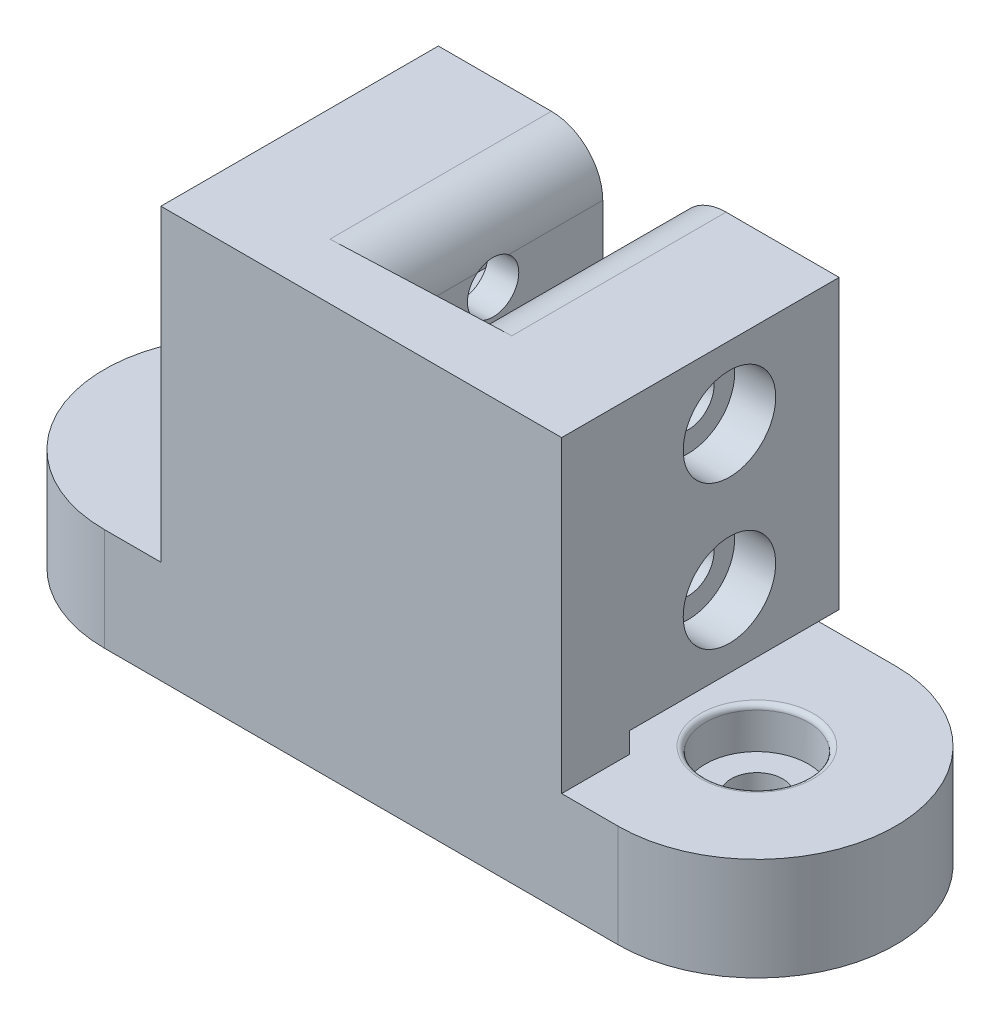
from build123d import *

# Parameters (mm, degrees)
CROQUIS1_R              = 2.5
SALIENTE_EXTRUIR1_DEPTH = 10
CROQUIS6_R              = 5
CORTAR_EXTRUIR1_DEPTH   = 4
REDONDEO3_R             = 0.5
SALIENTE_EXTRUIR2_DEPTH = 30
CROQUIS8_W              = 16
CROQUIS8_H              = 22
SALIENTE_EXTRUIR3_DEPTH = 28
CROQUIS9_R              = 4.5
CORTAR_EXTRUIR2_DEPTH   = 4
CORTAR_EXTRUIR3_REACH   = 70.544
CROQUIS10_R             = 2.5
CORTAR_EXTRUIR4_START   = -4
CROQUIS11_R             = 4.5
CORTAR_EXTRUIR4_DEPTH   = 4
REDONDEO4_R             = 5
CROQUIS13_W             = 4
CROQUIS13_H             = 10
CORTAR_EXTRUIR6_DEPTH   = 17


with BuildPart() as part:
    # Croquis1 → Saliente-Extruir1 (new body)
    with BuildSketch(Plane(origin=(0, 0, 0), x_dir=(1, 0, 0), z_dir=(0, 1, 0))):
        with BuildLine():
            Line((0, -13.5), (-50, -13.5))
            ThreePointArc((-50, -13.5), (-63.5, 0), (-50, 13.5))
            Line((-50, 13.5), (0, 13.5))
            ThreePointArc((0, 13.5), (13.5, 0), (0, -13.5))
        make_face()
        with Locations(Location((-50, 0, 0), (0, 0, 270))):
            Circle(CROQUIS1_R, mode=Mode.SUBTRACT)
        with Locations(Location((0, 0, 0), (0, 0, 90))):
            Circle(CROQUIS1_R, mode=Mode.SUBTRACT)
    extrude(amount=SALIENTE_EXTRUIR1_DEPTH)

    # Croquis6 → Cortar-Extruir1 (cut, symmetric)
    with BuildSketch(Plane(origin=(0, 10, 0), x_dir=(1, 0, 0), z_dir=(0, 1, 0))):
        with Locations(Location((-50, 0, 0), (0, 0, 270))):
            Circle(CROQUIS6_R)
        with Locations(Location((0, 0, 0), (0, 0, 270))):
            Circle(CROQUIS6_R)
    extrude(amount=CORTAR_EXTRUIR1_DEPTH, both=True, mode=Mode.SUBTRACT)

    # Redondeo3
    redondeo3_edges = [part.edges().sort_by_distance(p)[0] for p in [
        (-50, 10, -5),
        (0, 10, -5),
    ]]
    fillet(redondeo3_edges, radius=REDONDEO3_R)

    # Croquis7 → Saliente-Extruir2 (add)
    with BuildSketch(Plane(origin=(0, 10, 0), x_dir=(1, 0, 0), z_dir=(0, 1, 0))):
        Polygon((-44.5, -8.5), (-5.5, -6.9), (-5.5, -13.5), (-44.5, -13.5), align=None)
    extrude(amount=SALIENTE_EXTRUIR2_DEPTH)

    # Croquis8 → Saliente-Extruir3 (add)
    with BuildSketch(Plane(origin=(0, 40, 0), x_dir=(1, 0, 0), z_dir=(0, 1, 0))):
        with Locations((-13.5, 2.5)):
            Rectangle(CROQUIS8_W, CROQUIS8_H)
        with Locations((-36.5, 2.5)):
            Rectangle(CROQUIS8_W, CROQUIS8_H)
    extrude(amount=-SALIENTE_EXTRUIR3_DEPTH)

    # Croquis9 → Cortar-Extruir2 (cut)
    with BuildSketch(Plane(origin=(-5.5, 0, 0), x_dir=(0, 0, -1), z_dir=(1, 0, 0))):
        with Locations((2.828205128, 33)):
            Circle(CROQUIS9_R)
        with Locations(Location((2.828205128, 19, 0), (0, 0, 180))):
            Circle(CROQUIS9_R)
    extrude(amount=-CORTAR_EXTRUIR2_DEPTH, mode=Mode.SUBTRACT)

    # Cortar-Extruir3: up to this face of the body (flat: up to its plane)
    cortar_extruir3_end = Plane(part.part.faces().sort_by_distance((-44.5, 25.804177546, 0.143603133))[0])
    # Croquis10 → Cortar-Extruir3 (cut, up to the picked face)
    with BuildSketch(Plane(origin=(-9.5, 0, 0), x_dir=(0, 0, -1), z_dir=(1, 0, 0)), mode=Mode.PRIVATE) as cortar_extruir3_sk1:
        with Locations((2.828205128, 33)):
            Circle(CROQUIS10_R)
    cortar_extruir3_tool1 = split(extrude(cortar_extruir3_sk1.sketch, amount=-CORTAR_EXTRUIR3_REACH, mode=Mode.PRIVATE), bisect_by=cortar_extruir3_end, keep=Keep.BOTH, mode=Mode.PRIVATE)
    # Croquis10 → Cortar-Extruir3 (cut, up to the picked face)
    with BuildSketch(Plane(origin=(-9.5, 0, 0), x_dir=(0, 0, -1), z_dir=(1, 0, 0)), mode=Mode.PRIVATE) as cortar_extruir3_sk2:
        with Locations(Location((2.828205128, 19, 0), (0, 0, 180))):
            Circle(CROQUIS10_R)
    cortar_extruir3_tool2 = split(extrude(cortar_extruir3_sk2.sketch, amount=-CORTAR_EXTRUIR3_REACH, mode=Mode.PRIVATE), bisect_by=cortar_extruir3_end, keep=Keep.BOTH, mode=Mode.PRIVATE)
    add(cortar_extruir3_tool1.solids().sort_by(Axis((-9.5, 33, -2.828205), (-1, 0, 0)))[0], mode=Mode.SUBTRACT)
    add(cortar_extruir3_tool2.solids().sort_by(Axis((-9.5, 19, -2.828205), (-1, 0, 0)))[0], mode=Mode.SUBTRACT)

    # Croquis11 → Cortar-Extruir4 (cut)
    with BuildSketch(Plane.ZY.offset(44.5).offset(CORTAR_EXTRUIR4_START)):
        with Locations(Location((-2.828205128, 33, 0), (0, 0, 180))):
            Circle(CROQUIS11_R)
        with Locations((-2.828205128, 19)):
            Circle(CROQUIS11_R)
    extrude(amount=CORTAR_EXTRUIR4_DEPTH, mode=Mode.SUBTRACT)

    # Redondeo4
    # the kernel refuses this fillet: 5 mm, written as the material it takes off along each edge
    with BuildSketch(Plane(origin=(-28.5, 40, 20.343589744), x_dir=(-1, 0, 0), z_dir=(0, 0, -1))) as redondeo4_piece_1_section:
        with BuildLine():
            CenterArc((REDONDEO4_R, -REDONDEO4_R), REDONDEO4_R, 90, 90)
            Line((0, -REDONDEO4_R), (0, 0))
            Line((0, 0), (REDONDEO4_R, 0))
        make_face()
    redondeo4_piece_1 = extrude(amount=46.343589744, mode=Mode.PRIVATE)
    redondeo4_piece_1 = split(redondeo4_piece_1, bisect_by=Plane(origin=(-29.180561705, 38.884335507, 7.871510224), z_dir=(-0.04099115935241428, 0, -0.9991595092150929)), keep=Keep.TOP, mode=Mode.PRIVATE)
    add(redondeo4_piece_1, mode=Mode.SUBTRACT)
    with BuildSketch(Plane(origin=(-21.5, 40, -26), x_dir=(1, 0, 0), z_dir=(0, 0, 1))) as redondeo4_piece_2_section:
        with BuildLine():
            CenterArc((REDONDEO4_R, -REDONDEO4_R), REDONDEO4_R, 90, 90)
            Line((0, -REDONDEO4_R), (0, 0))
            Line((0, 0), (REDONDEO4_R, 0))
        make_face()
    redondeo4_piece_2 = extrude(amount=46.056410256, mode=Mode.PRIVATE)
    redondeo4_piece_2 = split(redondeo4_piece_2, bisect_by=Plane(origin=(-19.954554265, 38.882337261, 7.493007354), z_dir=(-0.04099115935241428, 0, -0.9991595092150929)), keep=Keep.TOP, mode=Mode.PRIVATE)
    add(redondeo4_piece_2, mode=Mode.SUBTRACT)

    # Croquis13 → Cortar-Extruir6 (cut)
    with BuildSketch(Plane(origin=(0, 0, -13.5), x_dir=(-1, 0, 0), z_dir=(0, 0, -1))):
        with Locations((16.5, 33)):
            Rectangle(CROQUIS13_W, CROQUIS13_H)
        with Locations((16.5, 19)):
            Rectangle(CROQUIS13_W, CROQUIS13_H)
        with Locations((33.5, 19)):
            Rectangle(CROQUIS13_W, CROQUIS13_H)
        with Locations((33.5, 33)):
            Rectangle(CROQUIS13_W, CROQUIS13_H)
    extrude(amount=-CORTAR_EXTRUIR6_DEPTH, mode=Mode.SUBTRACT)


solid = part.part
